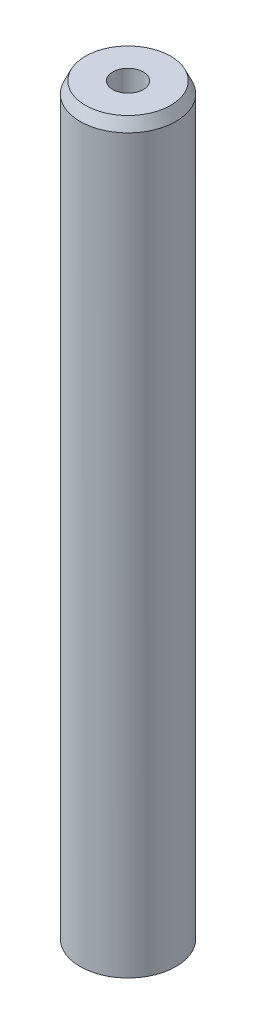
from build123d import *
from OCP.BRepFilletAPI import BRepFilletAPI_MakeChamfer

# Parameters (mm, degrees)
SKETCH1_R           = 12.5
BOSS_EXTRUDE1_DEPTH = 195.282222418
SKETCH2_R           = 3.98482293
CUT_EXTRUDE1_DEPTH  = 197.080713974
CHAMFER1_SIZE       = 2.948393677
CHAMFER1_SIZE2      = 1.386507238


with BuildPart() as part:
    # Sketch1 → Boss-Extrude1 (new body)
    with BuildSketch(Plane(origin=(0, 0, 0), x_dir=(1, 0, 0), z_dir=(0, 1, 0))):
        Circle(SKETCH1_R)
    extrude(amount=BOSS_EXTRUDE1_DEPTH)

    # Sketch2 → Cut-Extrude1 (cut, through all)
    with BuildSketch(Plane(origin=(0, 0, 0), x_dir=(1, 0, 0), z_dir=(0, 1, 0))):
        Circle(SKETCH2_R)
    extrude(amount=CUT_EXTRUDE1_DEPTH, mode=Mode.SUBTRACT)

    # Chamfer1: one chamfer whose edges measure the first distance from different faces: ONE call of the kernel's chamfer builder (chamfer() names one face for all edges)
    chamfer1_edges_1 = [part.edges().sort_by_distance(p)[0] for p in [
        (-12.5, 195.282222418, 0),
    ]]
    chamfer1_side_1 = [part.faces().sort_by_distance(p)[0] for p in [
        (-12.5, 97.641111209, 0),
    ]]
    chamfer1_edges_2 = [part.edges().sort_by_distance(p)[0] for p in [
        (-12.5, 0, 0),
    ]]
    chamfer1_side_2 = [part.faces().sort_by_distance(p)[0] for p in [
        (-12.146446609, 0, 0),
    ]]
    chamfer1 = BRepFilletAPI_MakeChamfer(part.part.solid().wrapped)
    for e in chamfer1_edges_1:
        chamfer1.Add(CHAMFER1_SIZE, CHAMFER1_SIZE2, e.wrapped, chamfer1_side_1[0].wrapped)  # the first distance lies on this face
    for e in chamfer1_edges_2:
        chamfer1.Add(CHAMFER1_SIZE, CHAMFER1_SIZE2, e.wrapped, chamfer1_side_2[0].wrapped)  # the first distance lies on this face
    add(Compound.cast(chamfer1.Shape()), mode=Mode.REPLACE)


solid = part.part
